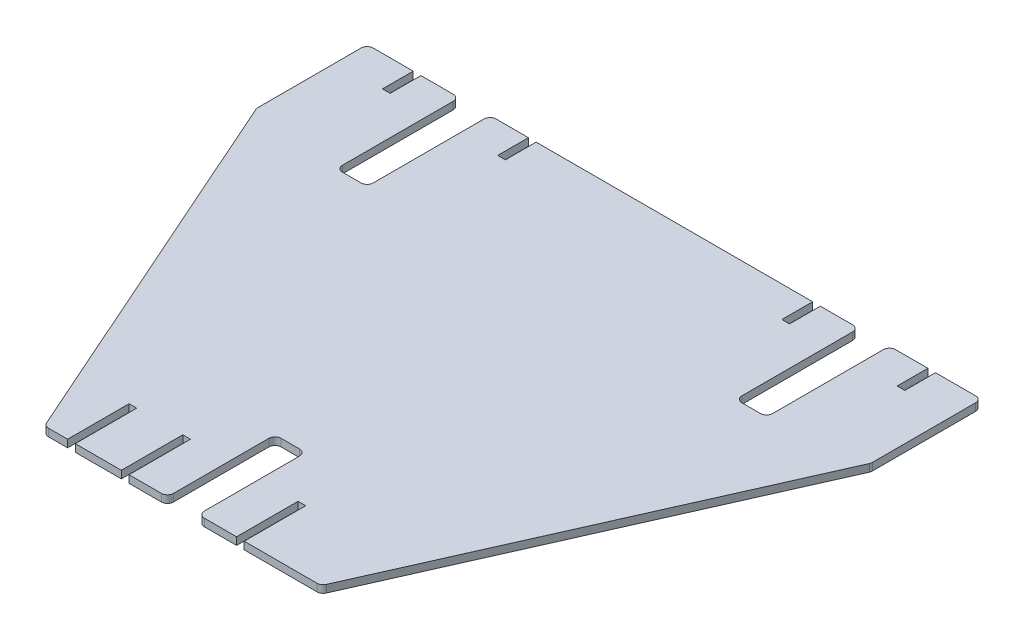
from build123d import *

# Parameters (mm, degrees)
BOSS_EXTRUDE1_DEPTH = 3.0988
FILLET1_R           = 2.54


with BuildPart() as part:
    # Sketch1 → Boss-Extrude1 (new body)
    with BuildSketch(Plane(origin=(0, 0, 0), x_dir=(1, 0, 0), z_dir=(0, 1, 0))):
        Polygon((6.35, -57.15), (-6.35, -57.15), (-6.35, -101.6), (-22.225, -101.6), (-22.225, -76.2), (-25.4, -76.2), (-25.4, -101.6), (-44.45, -101.6), (-44.45, -76.2), (-47.625, -76.2), (-47.625, -101.6), (-57.15, -101.6), (-127, 55.88), (-127, 101.6), (-107.95, 101.6), (-107.95, 88.9), (-104.775, 88.9), (-104.775, 101.6), (-88.9, 101.6), (-88.9, 50.8), (-76.2, 50.8), (-76.2, 101.6), (-60.325, 101.6), (-60.325, 88.9), (-57.15, 88.9), (-57.15, 101.6), (57.15, 101.6), (57.15, 88.9), (60.325, 88.9), (60.325, 101.6), (76.2, 101.6), (76.2, 50.8), (88.9, 50.8), (88.9, 101.6), (104.775, 101.6), (104.775, 88.9), (107.95, 88.9), (107.95, 101.6), (127, 101.6), (127, 55.88), (57.15, -101.6), (25.4, -101.6), (25.4, -76.2), (22.225, -76.2), (22.225, -101.6), (6.35, -101.6), align=None)
    extrude(amount=BOSS_EXTRUDE1_DEPTH)

    # Fillet1
    fillet1_edges = [part.edges().sort_by_distance(p)[0] for p in [
        (88.9, 1.5494, -50.8),
        (88.9, 1.5494, -101.6),
        (6.35, 1.5494, 101.6),
        (6.35, 1.5494, 57.15),
        (-6.35, 1.5494, 57.15),
        (-6.35, 1.5494, 101.6),
        (-127, 1.5494, -55.88),
        (-127, 1.5494, -101.6),
        (-88.9, 1.5494, -101.6),
        (-88.9, 1.5494, -50.8),
        (-76.2, 1.5494, -50.8),
        (-76.2, 1.5494, -101.6),
        (76.2, 1.5494, -101.6),
        (76.2, 1.5494, -50.8),
        (127, 1.5494, -101.6),
        (127, 1.5494, -55.88),
        (57.15, 1.5494, 101.6),
        (-57.15, 1.5494, 101.6),
    ]]
    fillet(fillet1_edges, radius=FILLET1_R)


solid = part.part
